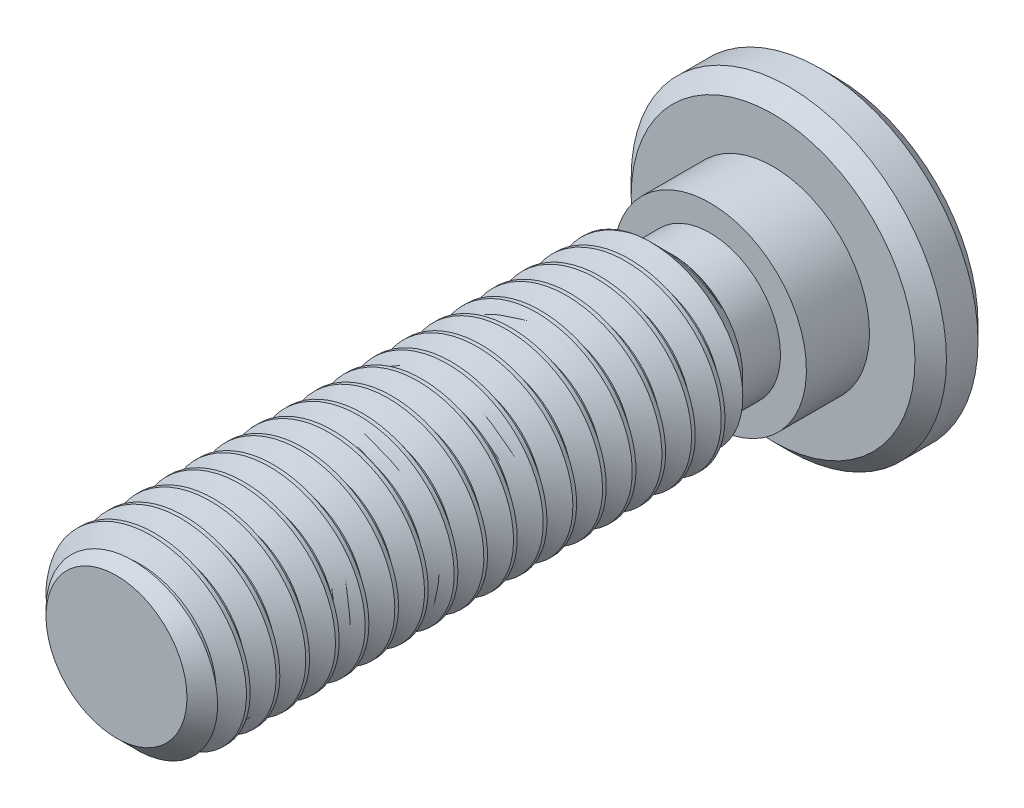
from build123d import *

# Parameters (mm, degrees)
CHAMFER2_SIZE      = 0.6
CUT_EXTRUDE1_DEPTH = 2.25
CHAMFER1_SIZE      = 0.425
CUT_SWEEP1_PITCH   = 0.8


with BuildPart() as part:
    # Sketch13 → Revolve1 (revolve)
    with BuildSketch(Plane(origin=(0, 0, 0), x_dir=(0, 0, -1), z_dir=(1, 0, 0)), mode=Mode.PRIVATE) as revolve1_sk:
        Polygon((1.7, 4.25), (0, 4.25), (0, 2.6), (-1.7, 2.6), (-1.7, 1.9), (-2.716, 1.9), (-3.316, 2.5), (-17.7, 2.5), (-17.7, 0), (1.7, 0), align=None)
    revolve(revolve1_sk.sketch.rotate(Axis((0, 0, 17.7), (0, 0, -1)), 180), axis=Axis((0, 0, 17.7), (0, 0, -1)))

    # Chamfer2
    chamfer2_edges = [part.edges().sort_by_distance(p)[0] for p in [
        (0, 2.5, 17.7),
    ]]
    chamfer(chamfer2_edges, length=CHAMFER2_SIZE)

    # Sketch7 → Cut-Extrude1 (cut)
    with BuildSketch(Plane(origin=(0, 0, -1.7), x_dir=(-1, 0, 0), z_dir=(0, 0, -1))):
        Polygon((0, 1.732050808), (-1.5, 0.866025404), (-1.5, -0.866025404), (0, -1.732050808), (1.5, -0.866025404), (1.5, 0.866025404), align=None)
    extrude(amount=-CUT_EXTRUDE1_DEPTH, mode=Mode.SUBTRACT)

    # Chamfer1
    chamfer1_edges = [part.edges().sort_by_distance(p)[0] for p in [
        (0, 4.25, 0),
        (0, 4.25, -1.7),
    ]]
    chamfer(chamfer1_edges, length=CHAMFER1_SIZE)

    # Cut-Extrude2 cone 1 section (through the dimple's axis) → Cut-Extrude2 (revolve, cut)
    with BuildSketch(Plane(origin=(0, 0, -1.7), x_dir=(0, 1, 0), z_dir=(1, 0, 0))):
        Polygon((0, 0), (1.732050808, 0), (0, 1.732050808), align=None)
    revolve(axis=Axis((0, 0, -1.7), (0, 0, 1)), mode=Mode.SUBTRACT)

    # Cut-Sweep1: the profile of Sketch3 screwed along a right-hand helix of 19.875 turns, 6 arcs to a turn; built about Z, then put on its axis
    cut_sweep1_z = Axis((0, 0, 0), (0, 0, 1))
    cut_sweep1_corners = [(2.54330127, 0, -0.725), (2.54330127, 0, 0.025), (1.980384758, 0, -0.3), (1.980384758, 0, -0.4)]
    with BuildLine(mode=Mode.PRIVATE) as cut_sweep1_profile:
        Line(cut_sweep1_corners[0], cut_sweep1_corners[1])
        Line(cut_sweep1_corners[1], cut_sweep1_corners[2])
        Line(cut_sweep1_corners[2], cut_sweep1_corners[3])
        Line(cut_sweep1_corners[3], cut_sweep1_corners[0])
    cut_sweep1_cap = Face(cut_sweep1_profile.wire())
    cut_sweep1_turn_angles = [0, 30, 60, 90, 120, 150, 180, 210, 240, 270, 300, 330, 360]
    cut_sweep1_turn_weights = [1, 0.8660254037844387, 1, 0.8660254037844387, 1, 0.8660254037844387, 1, 0.8660254037844387, 1, 0.8660254037844387, 1, 0.8660254037844387, 1]
    cut_sweep1_turn_rails = [Edge.make_bspline([Vector(p[0], p[1], 0).rotate(cut_sweep1_z, cut_sweep1_turn_angles[k]) / cut_sweep1_turn_weights[k] + Vector(0, 0, p[2] + CUT_SWEEP1_PITCH * cut_sweep1_turn_angles[k] / 360) for k in range(13)], [0, 0, 0, 1, 1, 2, 2, 3, 3, 4, 4, 5, 5, 6, 6, 6], 2, cut_sweep1_turn_weights) for p in cut_sweep1_corners]
    cut_sweep1_turn_sides = [Face.make_surface_from_curves(cut_sweep1_turn_rails[p[0]], cut_sweep1_turn_rails[p[1]]) for p in [(0, 1), (1, 2), (2, 3), (3, 0)]]
    cut_sweep1_last_angles = [6840, 6870, 6900, 6930, 6960, 6990, 7020, 7050, 7080, 7110, 7140, 7147.5, 7155]
    cut_sweep1_last_weights = [1, 0.8660254037844387, 1, 0.8660254037844387, 1, 0.8660254037844387, 1, 0.8660254037844387, 1, 0.8660254037844387, 1, 0.9914448613738239, 1]
    cut_sweep1_last_rails = [Edge.make_bspline([Vector(p[0], p[1], 0).rotate(cut_sweep1_z, cut_sweep1_last_angles[k]) / cut_sweep1_last_weights[k] + Vector(0, 0, p[2] + CUT_SWEEP1_PITCH * cut_sweep1_last_angles[k] / 360) for k in range(13)], [0, 0, 0, 1, 1, 2, 2, 3, 3, 4, 4, 5, 5, 6, 6, 6], 2, cut_sweep1_last_weights) for p in cut_sweep1_corners]
    cut_sweep1_last_sides = [Face.make_surface_from_curves(cut_sweep1_last_rails[p[0]], cut_sweep1_last_rails[p[1]]) for p in [(0, 1), (1, 2), (2, 3), (3, 0)]]
    cut_sweep1 = Plane(origin=(0, 0, 17.7), x_dir=(0, 1, 0), z_dir=(0, 0, -1)) * Solid(Shell([*[p.moved(Location((0, 0, CUT_SWEEP1_PITCH * i))) for i in range(19) for p in cut_sweep1_turn_sides], *cut_sweep1_last_sides, cut_sweep1_cap, cut_sweep1_cap.rotate(cut_sweep1_z, 7155).moved(Location((0, 0, CUT_SWEEP1_PITCH * 7155 / 360)))]))
    add(cut_sweep1, mode=Mode.SUBTRACT)


solid = part.part
